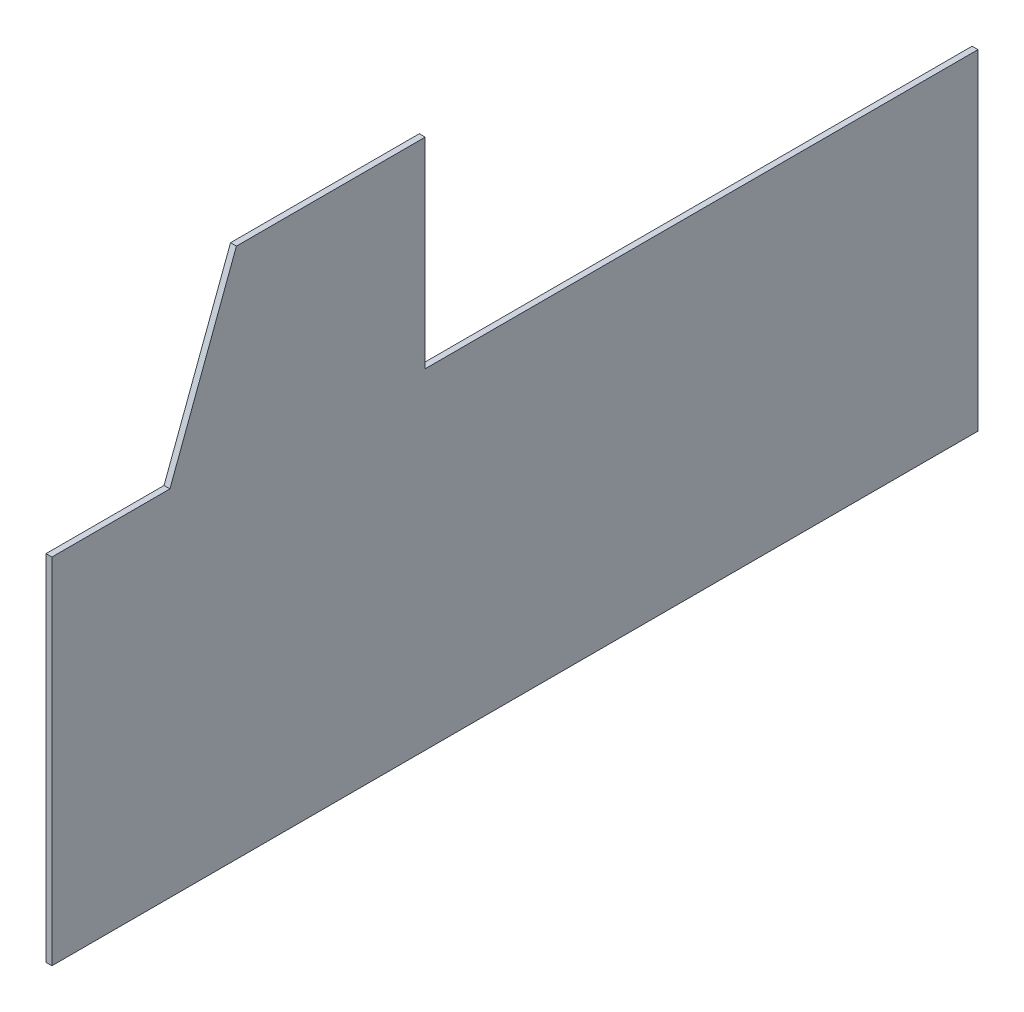
from build123d import *

# Parameters (mm, degrees)
SKETCH1_W           = 498.348
SKETCH1_H           = 177.8
BOSS_EXTRUDE1_DEPTH = 1.5875
BOSS_EXTRUDE2_DEPTH = 3.175


with BuildPart() as part:
    # Sketch1 → Boss-Extrude1 (new, symmetric)
    with BuildSketch(Plane(origin=(0, 0, 0), x_dir=(0, 0, -1), z_dir=(1, 0, 0))):
        Rectangle(SKETCH1_W, SKETCH1_H)
    extrude(amount=BOSS_EXTRUDE1_DEPTH, both=True)

    # Sketch2 → Boss-Extrude2 (add)
    with BuildSketch(Plane.ZY.offset(1.5875)):
        Polygon((48.2854, 196.85), (48.2854, 88.9), (249.174, 88.9), (249.174, 101.6), (185.674, 101.6), (149.8854, 196.85), align=None)
    extrude(amount=-BOSS_EXTRUDE2_DEPTH)


solid = part.part
